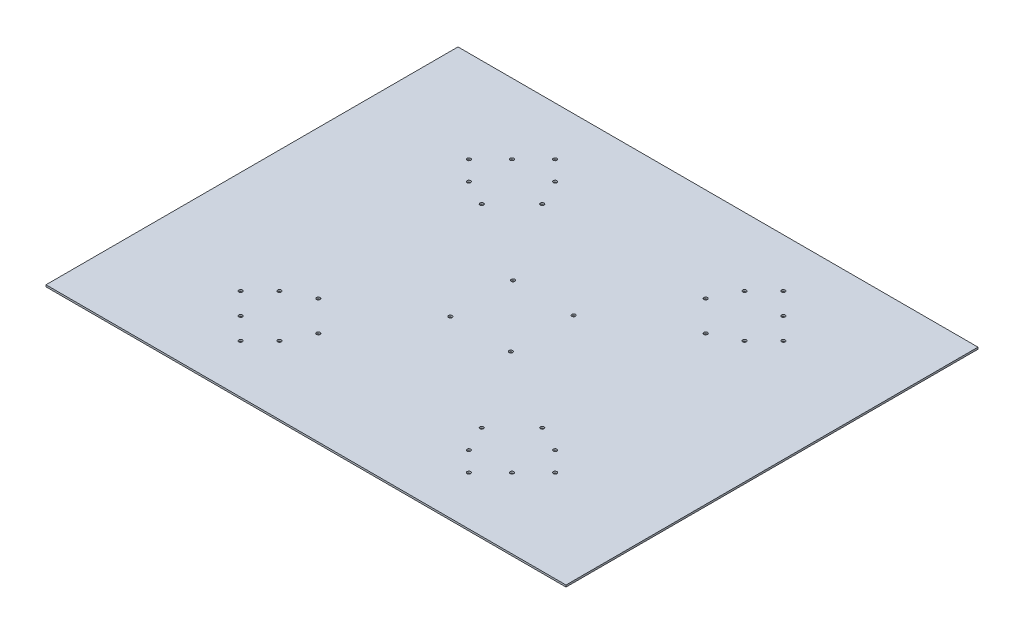
from build123d import *

# Parameters (mm, degrees)
SKETCH2_R           = 3
BOSS_EXTRUDE2_DEPTH = 3


with BuildPart() as part:
    # Sketch2 → Boss-Extrude2 (new body)
    with BuildSketch(Plane(origin=(0, 1310.548413309, 0), x_dir=(1, 0, 0), z_dir=(0, 1, 0))):
        Polygon((639.777273447, -1841.727226955), (739.777273447, -1841.727226955), (1391.777273447, -1841.727226955), (1491.777273447, -1841.727226955), (1491.777273447, -1166.727226955), (1391.777273447, -1166.727226955), (739.777273447, -1166.727226955), (639.777273447, -1166.727226955), align=None)
        with Locations((843.462901442, -1726.54159896)):
            Circle(SKETCH2_R, mode=Mode.SUBTRACT)
        with Locations((808.107562383, -1691.186259901)):
            Circle(SKETCH2_R, mode=Mode.SUBTRACT)
        with Locations((878.818240502, -1761.896938019)):
            Circle(SKETCH2_R, mode=Mode.SUBTRACT)
        with Locations((910.638045655, -1730.077132866)):
            Circle(SKETCH2_R, mode=Mode.SUBTRACT)
        with Locations((931.851249091, -1687.650725995)):
            Circle(SKETCH2_R, mode=Mode.SUBTRACT)
        with Locations((839.927367536, -1659.366454747)):
            Circle(SKETCH2_R, mode=Mode.SUBTRACT)
        with Locations((882.353774408, -1638.153251312)):
            Circle(SKETCH2_R, mode=Mode.SUBTRACT)
        with Locations((1016.145188589, -1555.610136892)):
            Circle(SKETCH2_R, mode=Mode.SUBTRACT)
        with Locations((1252.736306393, -1761.896938019)):
            Circle(SKETCH2_R, mode=Mode.SUBTRACT)
        with Locations((1220.91650124, -1730.077132866)):
            Circle(SKETCH2_R, mode=Mode.SUBTRACT)
        with Locations((1199.703297804, -1687.650725995)):
            Circle(SKETCH2_R, mode=Mode.SUBTRACT)
        with Locations((1288.091645453, -1726.54159896)):
            Circle(SKETCH2_R, mode=Mode.SUBTRACT)
        with Locations((1323.446984512, -1691.186259901)):
            Circle(SKETCH2_R, mode=Mode.SUBTRACT)
        with Locations((1249.200772487, -1638.153251312)):
            Circle(SKETCH2_R, mode=Mode.SUBTRACT)
        with Locations((1115.409358306, -1555.610136892)):
            Circle(SKETCH2_R, mode=Mode.SUBTRACT)
        with Locations((1291.627179358, -1659.366454747)):
            Circle(SKETCH2_R, mode=Mode.SUBTRACT)
        with Locations((839.927367536, -1349.087999163)):
            Circle(SKETCH2_R, mode=Mode.SUBTRACT)
        with Locations((1016.145188589, -1452.844317017)):
            Circle(SKETCH2_R, mode=Mode.SUBTRACT)
        with Locations((882.353774408, -1370.301202598)):
            Circle(SKETCH2_R, mode=Mode.SUBTRACT)
        with Locations((808.107562383, -1317.268194009)):
            Circle(SKETCH2_R, mode=Mode.SUBTRACT)
        with Locations((843.462901442, -1281.91285495)):
            Circle(SKETCH2_R, mode=Mode.SUBTRACT)
        with Locations((931.851249091, -1320.803727915)):
            Circle(SKETCH2_R, mode=Mode.SUBTRACT)
        with Locations((910.638045655, -1278.377321044)):
            Circle(SKETCH2_R, mode=Mode.SUBTRACT)
        with Locations((878.818240502, -1246.55751589)):
            Circle(SKETCH2_R, mode=Mode.SUBTRACT)
        with Locations((1115.409358306, -1452.844317017)):
            Circle(SKETCH2_R, mode=Mode.SUBTRACT)
        with Locations((1249.200772487, -1370.301202598)):
            Circle(SKETCH2_R, mode=Mode.SUBTRACT)
        with Locations((1291.627179358, -1349.087999163)):
            Circle(SKETCH2_R, mode=Mode.SUBTRACT)
        with Locations((1199.703297804, -1320.803727915)):
            Circle(SKETCH2_R, mode=Mode.SUBTRACT)
        with Locations((1220.91650124, -1278.377321044)):
            Circle(SKETCH2_R, mode=Mode.SUBTRACT)
        with Locations((1252.736306393, -1246.55751589)):
            Circle(SKETCH2_R, mode=Mode.SUBTRACT)
        with Locations((1323.446984512, -1317.268194009)):
            Circle(SKETCH2_R, mode=Mode.SUBTRACT)
        with Locations((1288.091645453, -1281.91285495)):
            Circle(SKETCH2_R, mode=Mode.SUBTRACT)
    extrude(amount=BOSS_EXTRUDE2_DEPTH)


solid = part.part
